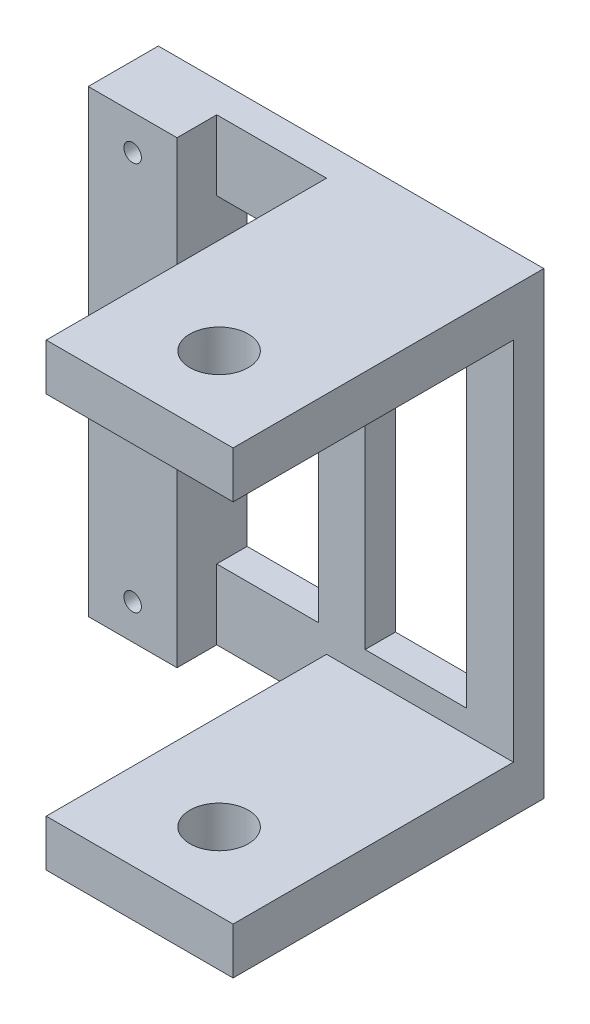
from build123d import *

# Parameters (mm, degrees)
SKETCH_2_W          = 16.5
SKETCH_2_H          = 19.65
SKETCH_2_W_2        = 4.35
SKETCH_2_H_2        = 13.65
EXTRUDE_1_DEPTH     = 1.3
SKETCH_3_W          = 8
SKETCH_3_H          = 2
EXTRUDE_2_DEPTH     = 12
SKETCH_10_W         = 3.8
SKETCH_10_H         = 19.65
EXTRUDE_4_DEPTH     = 1.7
CUT_EXTRUDE_2_REACH = 21.707
CUT_EXTRUDE_START   = 1.7
SKETCH_9_R          = 0.375
SKETCH_11_R         = 1.25
CUT_EXTRUDE_3_DEPTH = 26.430985038


with BuildPart() as part:
    # 草图2 → 凸台-拉伸1 (new body)
    with BuildSketch(Plane.XY):
        with Locations((-0.9, 0)):
            Rectangle(SKETCH_2_W, SKETCH_2_H)
        with Locations((-3.175, 0)):
            Rectangle(SKETCH_2_W_2, SKETCH_2_H_2, mode=Mode.SUBTRACT)
        with Locations((3.175, 0)):
            Rectangle(SKETCH_2_W_2, SKETCH_2_H_2, mode=Mode.SUBTRACT)
    extrude(amount=EXTRUDE_1_DEPTH)

    # 草图3 → 凸台-拉伸2 (add)
    with BuildSketch(Plane.XY.offset(1.3)):
        with Locations((3.35, 8.825)):
            Rectangle(SKETCH_3_W, SKETCH_3_H)
        with Locations((3.35, -8.825)):
            Rectangle(SKETCH_3_W, SKETCH_3_H)
    extrude(amount=EXTRUDE_2_DEPTH)

    # 草图10 → 凸台-拉伸4 (add)
    with BuildSketch(Plane.XY.offset(1.3)):
        with Locations((-7.25, 0)):
            Rectangle(SKETCH_10_W, SKETCH_10_H)
    extrude(amount=EXTRUDE_4_DEPTH)

    # 草图9 → 切除-拉伸2 (cut, up to next)
    with BuildSketch(Plane.XY.offset(1.3).offset(CUT_EXTRUDE_START), mode=Mode.PRIVATE) as cut_extrude_2_sk1:
        with Locations((-7.25, 8.325)):
            Circle(SKETCH_9_R)
    cut_extrude_2_tool1 = extrude(cut_extrude_2_sk1.sketch, amount=-CUT_EXTRUDE_2_REACH, mode=Mode.PRIVATE) & part.part
    # 草图9 → 切除-拉伸2 (cut, up to next)
    with BuildSketch(Plane.XY.offset(1.3).offset(CUT_EXTRUDE_START), mode=Mode.PRIVATE) as cut_extrude_2_sk2:
        with Locations((-7.25, -8.325)):
            Circle(SKETCH_9_R)
    cut_extrude_2_tool2 = extrude(cut_extrude_2_sk2.sketch, amount=-CUT_EXTRUDE_2_REACH, mode=Mode.PRIVATE) & part.part
    add(cut_extrude_2_tool1.solids().sort_by_distance((-7.25, 8.325, 3))[0], mode=Mode.SUBTRACT)
    add(cut_extrude_2_tool2.solids().sort_by_distance((-7.25, -8.325, 3))[0], mode=Mode.SUBTRACT)

    # 草图11 → 切除-拉伸3 (cut, through all)
    with BuildSketch(Plane.XZ.offset(9.825)):
        with Locations((3.45, 10)):
            Circle(SKETCH_11_R)
    extrude(amount=-CUT_EXTRUDE_3_DEPTH, mode=Mode.SUBTRACT)


solid = part.part
